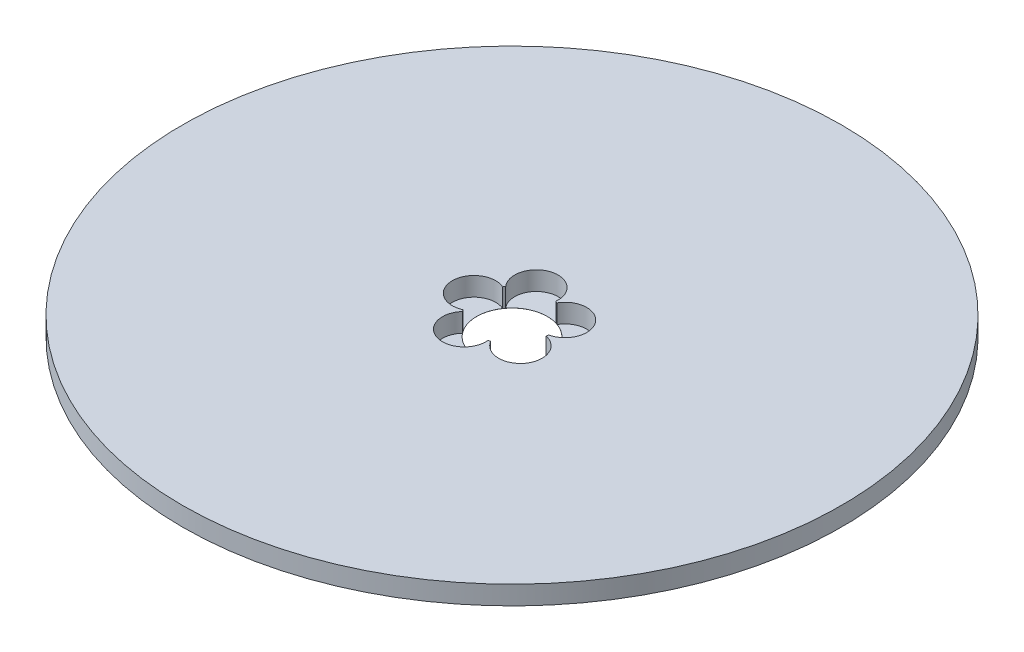
from build123d import *

# Parameters (mm, degrees)
SKETCH1_R           = 70
BOSS_EXTRUDE1_DEPTH = 4
SKETCH2_R           = 7.5
CUT_EXTRUDE1_DEPTH  = 100.075728612
SKETCH3_R           = 4.611490859
CUT_EXTRUDE2_DEPTH  = 3.991241774
CIRPATTERN1_COUNT   = 5


with BuildPart() as part:
    # Sketch1 → Boss-Extrude1 (new body)
    with BuildSketch(Plane(origin=(0, 0, 0), x_dir=(1, 0, 0), z_dir=(0, 1, 0))):
        Circle(SKETCH1_R)
    extrude(amount=BOSS_EXTRUDE1_DEPTH)

    # Sketch2 → Cut-Extrude1 (cut, through all)
    with BuildSketch(Plane(origin=(0, 0, 0), x_dir=(1, 0, 0), z_dir=(0, 1, 0))):
        Circle(SKETCH2_R)
    extrude(amount=CUT_EXTRUDE1_DEPTH, mode=Mode.SUBTRACT)

    # Sketch3 → Cut-Extrude2 (cut)
    with BuildSketch(Plane(origin=(0, 4, 0), x_dir=(1, 0, 0), z_dir=(0, 1, 0))):
        with Locations((-8.068224855, 0)):
            Circle(SKETCH3_R)
    cut_extrude2 = extrude(amount=-CUT_EXTRUDE2_DEPTH, mode=Mode.SUBTRACT)

    # CirPattern1: Cut-Extrude2 ×5 about axis
    cirpattern1_axis = Axis((0, 0, 0), (0, 1, 0))
    for i in range(1, CIRPATTERN1_COUNT):
        add(cut_extrude2.rotate(cirpattern1_axis, i * 360 / CIRPATTERN1_COUNT), mode=Mode.SUBTRACT)


solid = part.part
